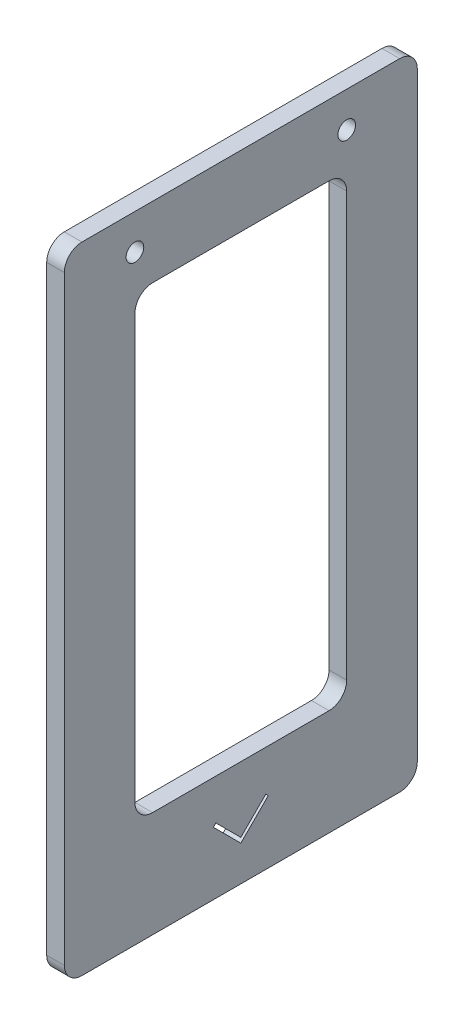
from build123d import *

# Parameters (mm, degrees)
BOSS_EXTRUDE2_DEPTH     = 6.35
CUT_EXTRUDE1_REACH      = 132.909
CUT_EXTRUDE2_DEPTH      = 131.908603613
CUT_EXTRUDE2_DEPTH_BACK = 131.908603613
SKETCH5_R               = 3.175


with BuildPart() as part:
    # Sketch3 → Boss-Extrude2 (new body)
    with BuildSketch(Plane(origin=(0, 0, 0), x_dir=(0, 0, -1), z_dir=(1, 0, 0))):
        with BuildLine():
            Line((-57.15, -114.3), (57.15, -114.3))
            ThreePointArc((57.15, -114.3), (61.640128061, -112.440128061), (63.5, -107.95))
            Line((63.5, -107.95), (63.5, 107.95))
            ThreePointArc((63.5, 107.95), (61.640128061, 112.440128061), (57.15, 114.3))
            Line((57.15, 114.3), (-57.15, 114.3))
            ThreePointArc((-57.15, 114.3), (-61.640128061, 112.440128061), (-63.5, 107.95))
            Line((-63.5, 107.95), (-63.5, -107.95))
            ThreePointArc((-63.5, -107.95), (-61.640128061, -112.440128061), (-57.15, -114.3))
        make_face()
        with BuildLine():
            Line((-31.75, -76.2), (31.75, -76.2))
            ThreePointArc((31.75, -76.2), (36.240128061, -74.340128061), (38.1, -69.85))
            Line((38.1, -69.85), (38.1, 82.55))
            ThreePointArc((38.1, 82.55), (36.240128061, 87.040128061), (31.75, 88.9))
            Line((31.75, 88.9), (-31.75, 88.9))
            ThreePointArc((-31.75, 88.9), (-36.240128061, 87.040128061), (-38.1, 82.55))
            Line((-38.1, 82.55), (-38.1, -69.85))
            ThreePointArc((-38.1, -69.85), (-36.240128061, -74.340128061), (-31.75, -76.2))
        make_face(mode=Mode.SUBTRACT)
    extrude(amount=BOSS_EXTRUDE2_DEPTH)

    # Sketch4 → Cut-Extrude1 (cut, up to next)
    with BuildSketch(Plane(origin=(6.35, 0, 0), x_dir=(0, 0, -1), z_dir=(1, 0, 0)), mode=Mode.PRIVATE) as cut_extrude1_sk1:
        Polygon((0, -99.803948776), (-8.980256121, -90.823692655), (-9.878281733, -91.721718267), (0, -101.6), (9.878281733, -91.721718267), (8.980256121, -90.823692655), align=None)
    cut_extrude1_tool1 = extrude(cut_extrude1_sk1.sketch, amount=-CUT_EXTRUDE1_REACH, mode=Mode.PRIVATE) & part.part
    add(cut_extrude1_tool1.solids().sort_by_distance((6.35, -95.472951, 4.649259))[0], mode=Mode.SUBTRACT)

    # Sketch5 → Cut-Extrude2 (cut, two sides: drawn at the far end of the back side and taken through both)
    with BuildSketch(Plane(origin=(6.35, 0, 0), x_dir=(0, 0, -1), z_dir=(1, 0, 0)).offset(-CUT_EXTRUDE2_DEPTH_BACK)):
        with Locations((-38.1, 101.6)):
            Circle(SKETCH5_R)
        with Locations((38.1, 101.6)):
            Circle(SKETCH5_R)
    extrude(amount=CUT_EXTRUDE2_DEPTH + CUT_EXTRUDE2_DEPTH_BACK, mode=Mode.SUBTRACT)


solid = part.part
